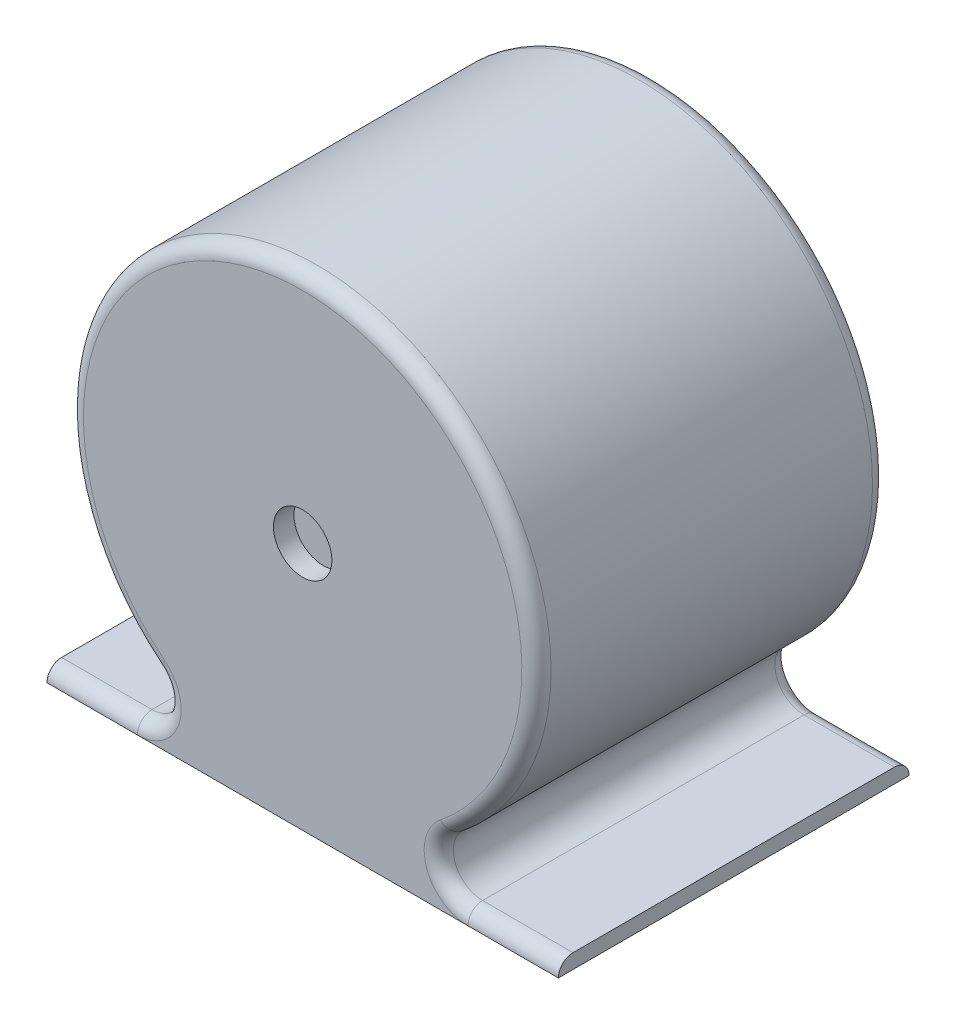
from build123d import *

# Parameters (mm, degrees)
SKETCH1_R           = 50.8
SKETCH1_W           = 111.125
SKETCH1_H           = 3.175
BOSS_EXTRUDE1_DEPTH = 38.1
SKETCH2_R           = 6.35
CUT_EXTRUDE1_DEPTH  = 4.445
FILLET1_R           = 3.175


with BuildPart() as part:
    # Sketch1 → Boss-Extrude1 (new, symmetric)
    with BuildSketch(Plane.XY):
        Circle(SKETCH1_R)
        with BuildLine():
            ThreePointArc((-31.929799542, -39.511111111), (-29.93418707, -46.566666667), (-35.921024484, -50.8))
            Line((-35.921024484, -50.8), (7.4e-08, -50.8))
            ThreePointArc((7.4e-08, -50.8), (-16.933333298, -47.894699325), (-31.929799542, -39.511111111))
        make_face()
        with BuildLine():
            Line((7.4e-08, -50.8), (35.921024484, -50.8))
            ThreePointArc((35.921024484, -50.8), (29.93418707, -46.566666667), (31.929799542, -39.511111111))
            ThreePointArc((31.929799542, -39.511111111), (16.933333368, -47.8946993), (7.4e-08, -50.8))
        make_face()
        with Locations((0, -52.3875)):
            Rectangle(SKETCH1_W, SKETCH1_H)
    extrude(amount=BOSS_EXTRUDE1_DEPTH, both=True)

    # Sketch2 → Cut-Extrude1 (cut)
    with BuildSketch(Plane.XY.offset(38.1)):
        Circle(SKETCH2_R)
    extrude(amount=-CUT_EXTRUDE1_DEPTH, mode=Mode.SUBTRACT)

    # Fillet1
    fillet1_edges = [part.edges().sort_by_distance(p)[0] for p in [
        (45.741762242, -50.8, -38.1),
        (45.741762242, -50.8, 38.1),
        (29.93418707, -46.566666667, -38.1),
        (29.93418707, -46.566666667, 38.1),
        (-45.741762242, -50.8, -38.1),
        (-45.741762242, -50.8, 38.1),
        (-29.93418707, -46.566666667, -38.1),
        (-29.93418707, -46.566666667, 38.1),
        (0, 50.8, -38.1),
        (0, 50.8, 38.1),
    ]]
    fillet(fillet1_edges, radius=FILLET1_R - 0.0001)  # a hair under: the kernel refuses the full size


solid = part.part
